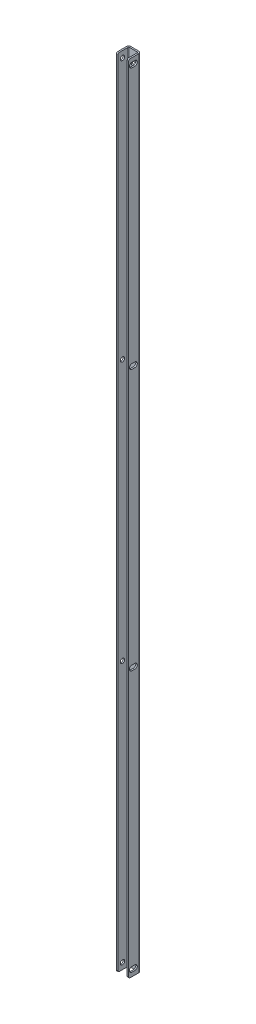
from build123d import *

# Parameters (mm, degrees)
BASE_FLANGE1_DEPTH = 1613
CUT_EXTRUDE1_REACH = 1615.387
SKETCH6_R          = 4.5
FILLET1_R          = 3
CUT_EXTRUDE2_REACH = 1615.387
LPATTERN1_COUNT    = 4
LPATTERN1_PITCH    = 529
CUT_EXTRUDE3_REACH = 1615.198
SKETCH11_R         = 4.5
LPATTERN2_COUNT    = 3
LPATTERN2_PITCH    = 529
CUT_EXTRUDE4_REACH = 1615.198
SKETCH12_R         = 4.5


# Sheet-metal steps are written as plain solids
with BuildPart() as part:
    # Sketch1 → Base-Flange1 (new body)
    with BuildSketch(Plane(origin=(0, 0, 0), x_dir=(1, 0, 0), z_dir=(0, 1, 0))):
        with BuildLine():
            Line((-12.5, -25), (-12.5, -4.5))
            ThreePointArc((-12.5, -4.5), (-11.181980515, -1.318019485), (-8, 0))
            Line((-8, 0), (8, 0))
            ThreePointArc((8, 0), (11.181980515, -1.318019485), (12.5, -4.5))
            Line((12.5, -4.5), (12.5, -25))
            Line((12.5, -25), (9.5, -25))
            Line((9.5, -25), (9.5, -4.5))
            ThreePointArc((9.5, -4.5), (9.060660172, -3.439339828), (8, -3))
            Line((8, -3), (-8, -3))
            ThreePointArc((-8, -3), (-9.060660172, -3.439339828), (-9.5, -4.5))
            Line((-9.5, -4.5), (-9.5, -25))
            Line((-9.5, -25), (-12.5, -25))
        make_face()
    extrude(amount=BASE_FLANGE1_DEPTH)

    # Sketch6 → Cut-Extrude1 (cut, up to next)
    with BuildSketch(Plane.ZY.offset(12.5), mode=Mode.PRIVATE) as cut_extrude1_sk1:
        with Locations((15.5, 13)):
            Circle(SKETCH6_R)
    cut_extrude1_tool1 = extrude(cut_extrude1_sk1.sketch, amount=-CUT_EXTRUDE1_REACH, mode=Mode.PRIVATE) & part.part
    cut_extrude1 = cut_extrude1_tool1.solids().sort_by_distance((-12.5, 13, 15.5))[0]
    add(cut_extrude1, mode=Mode.SUBTRACT)

    # Fillet1
    fillet1_edges = [part.edges().sort_by_distance(p)[0] for p in [
        (11, 0, 25),
        (-11, 0, 25),
        (11, 1613, 25),
        (-11, 1613, 25),
    ]]
    fillet(fillet1_edges, radius=FILLET1_R)

    # Sketch7 → Cut-Extrude2 (cut, up to next)
    with BuildSketch(Plane(origin=(12.5, 0, 0), x_dir=(0, 0, -1), z_dir=(1, 0, 0)), mode=Mode.PRIVATE) as cut_extrude2_sk1:
        with BuildLine():
            Line((-18.5, 18), (-12.5, 18))
            ThreePointArc((-12.5, 18), (-7.5, 13), (-12.5, 8))
            Line((-12.5, 8), (-18.5, 8))
            ThreePointArc((-18.5, 8), (-23.5, 13), (-18.5, 18))
        make_face()
    cut_extrude2_tool1 = extrude(cut_extrude2_sk1.sketch, amount=-CUT_EXTRUDE2_REACH, mode=Mode.PRIVATE) & part.part
    cut_extrude2 = cut_extrude2_tool1.solids().sort_by_distance((12.5, 13, 15.5))[0]
    add(cut_extrude2, mode=Mode.SUBTRACT)

    # LPattern1: Cut-Extrude1, Cut-Extrude2 ×4
    with Locations(*[(0, i * LPATTERN1_PITCH, 0) for i in range(1, LPATTERN1_COUNT)]):
        add(cut_extrude1, mode=Mode.SUBTRACT)
        add(cut_extrude2, mode=Mode.SUBTRACT)

    # Sketch11 → Cut-Extrude3 (cut, up to next)
    with BuildSketch(Plane.XY.offset(3), mode=Mode.PRIVATE) as cut_extrude3_sk1:
        with Locations((0, 25)):
            Circle(SKETCH11_R)
    cut_extrude3_tool1 = extrude(cut_extrude3_sk1.sketch, amount=-CUT_EXTRUDE3_REACH, mode=Mode.PRIVATE) & part.part
    cut_extrude3 = cut_extrude3_tool1.solids().sort_by_distance((0, 25, 3))[0]
    add(cut_extrude3, mode=Mode.SUBTRACT)

    # LPattern2: Cut-Extrude3 ×3
    with Locations(*[(0, i * LPATTERN2_PITCH, 0) for i in range(1, LPATTERN2_COUNT)]):
        add(cut_extrude3, mode=Mode.SUBTRACT)

    # Sketch12 → Cut-Extrude4 (cut, up to next)
    with BuildSketch(Plane.XY.offset(3), mode=Mode.PRIVATE) as cut_extrude4_sk1:
        with Locations((0, 1588)):
            Circle(SKETCH12_R)
    cut_extrude4_tool1 = extrude(cut_extrude4_sk1.sketch, amount=-CUT_EXTRUDE4_REACH, mode=Mode.PRIVATE) & part.part
    add(cut_extrude4_tool1.solids().sort_by_distance((0, 1588, 3))[0], mode=Mode.SUBTRACT)


solid = part.part
